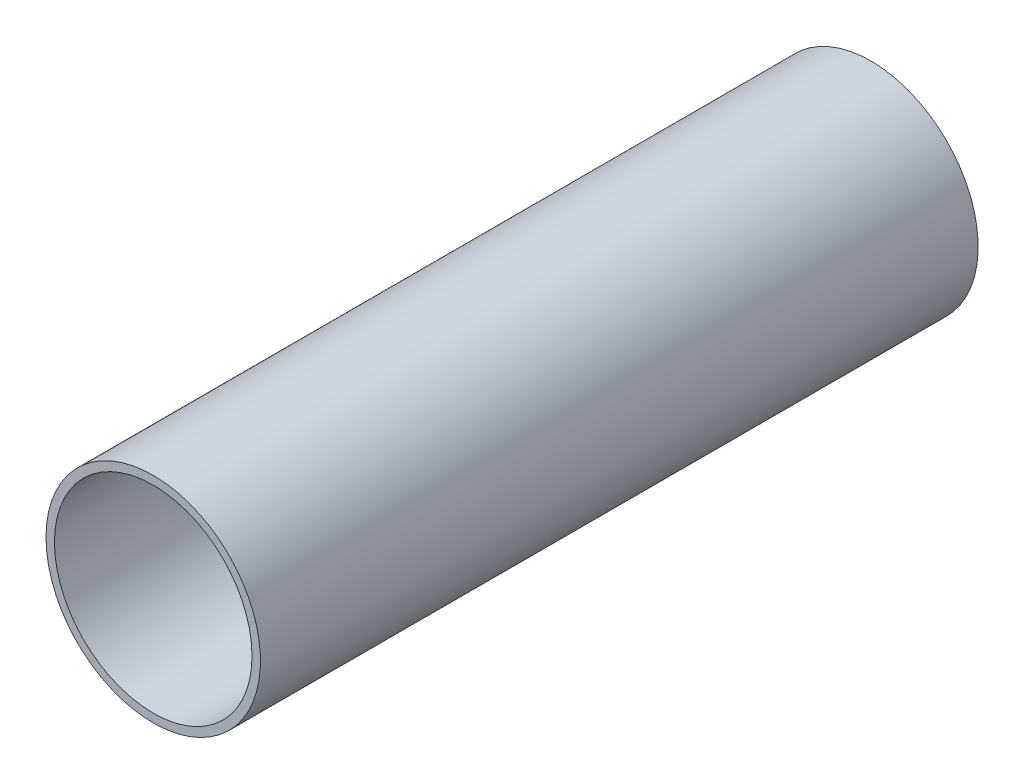
from build123d import *

# Parameters (mm, degrees)
SWEEP_THIN_PROFILE_R   = 12.7
SWEEP_THIN_PROFILE_R_2 = 11.7


with BuildPart() as part:
    # Sweep-Thin: sweep along a path in Path
    with BuildLine(Plane(origin=(0, 0, 0), x_dir=(0, 0, -1), z_dir=(1, 0, 0))) as sweep_thin_path:
        Line((0, 0), (85, 0))
    # Sweep-Thin profile (on start of the path) → Sweep-Thin (sweep)
    with BuildSketch(Plane(origin=(0, 0, 0), x_dir=(-1, 0, 0), z_dir=(0, 0, -1))):
        Circle(SWEEP_THIN_PROFILE_R)
        Circle(SWEEP_THIN_PROFILE_R_2, mode=Mode.SUBTRACT)
    sweep(path=sweep_thin_path.line)


solid = part.part
